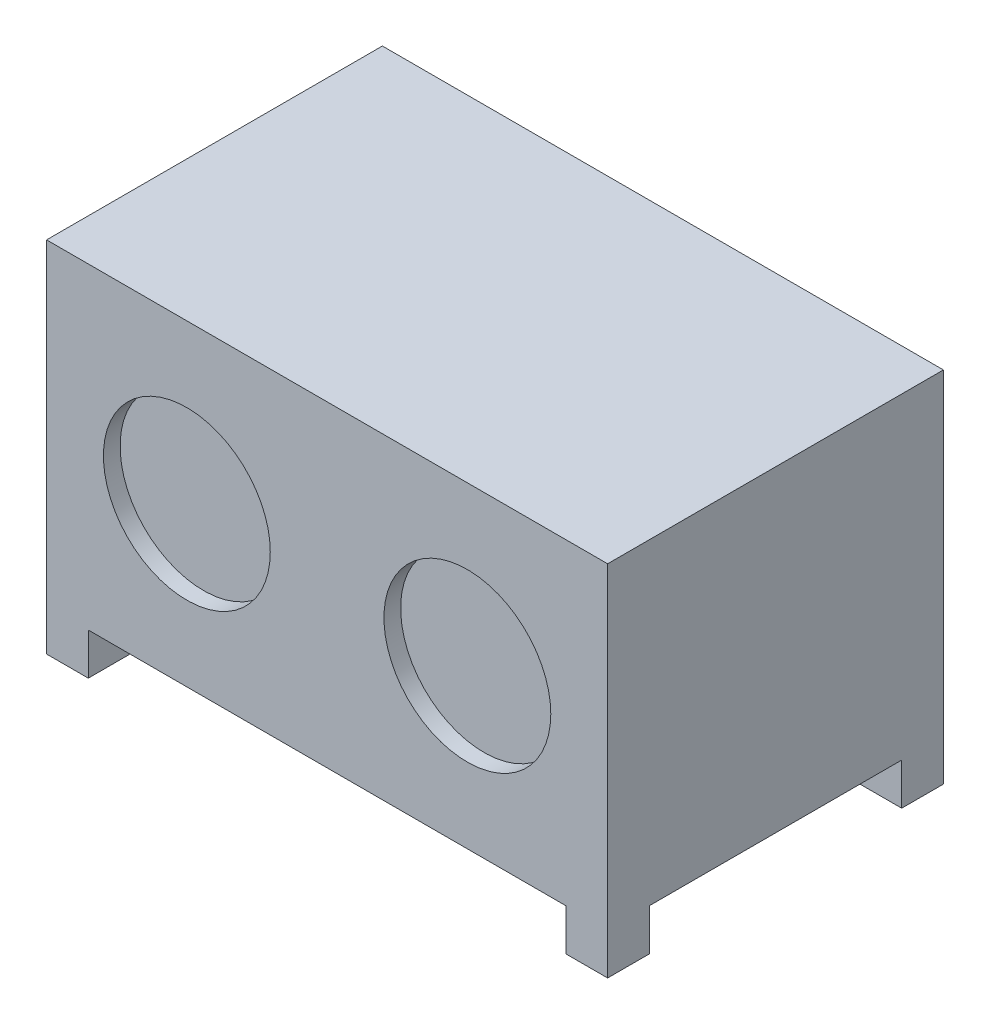
from build123d import *

# Parameters (mm, degrees)
SKETCH1_W           = 1708.15
SKETCH1_H           = 1022.35
BOSS_EXTRUDE1_DEPTH = 965.2
SKETCH2_R           = 254
CUT_EXTRUDE1_DEPTH  = 50.8
SKETCH3_W           = 127
SKETCH3_H           = 127
BOSS_EXTRUDE2_DEPTH = 127


with BuildPart() as part:
    # Sketch1 → Boss-Extrude1 (new body)
    with BuildSketch(Plane(origin=(0, 0, 0), x_dir=(1, 0, 0), z_dir=(0, 1, 0))):
        Rectangle(SKETCH1_W, SKETCH1_H)
    extrude(amount=BOSS_EXTRUDE1_DEPTH)

    # Sketch2 → Cut-Extrude1 (cut)
    with BuildSketch(Plane.XY.offset(511.175)):
        with Locations((427.0375, 482.6)):
            Circle(SKETCH2_R)
        with Locations((-427.0375, 482.6)):
            Circle(SKETCH2_R)
    extrude(amount=-CUT_EXTRUDE1_DEPTH, mode=Mode.SUBTRACT)

    # Sketch3 → Boss-Extrude2 (add)
    with BuildSketch(Plane.XZ):
        with Locations((-790.575, 447.675)):
            Rectangle(SKETCH3_W, SKETCH3_H)
        with Locations((-790.575, -447.675)):
            Rectangle(SKETCH3_W, SKETCH3_H)
        with Locations((790.575, 447.675)):
            Rectangle(SKETCH3_W, SKETCH3_H)
        with Locations((790.575, -447.675)):
            Rectangle(SKETCH3_W, SKETCH3_H)
    extrude(amount=BOSS_EXTRUDE2_DEPTH)


solid = part.part
